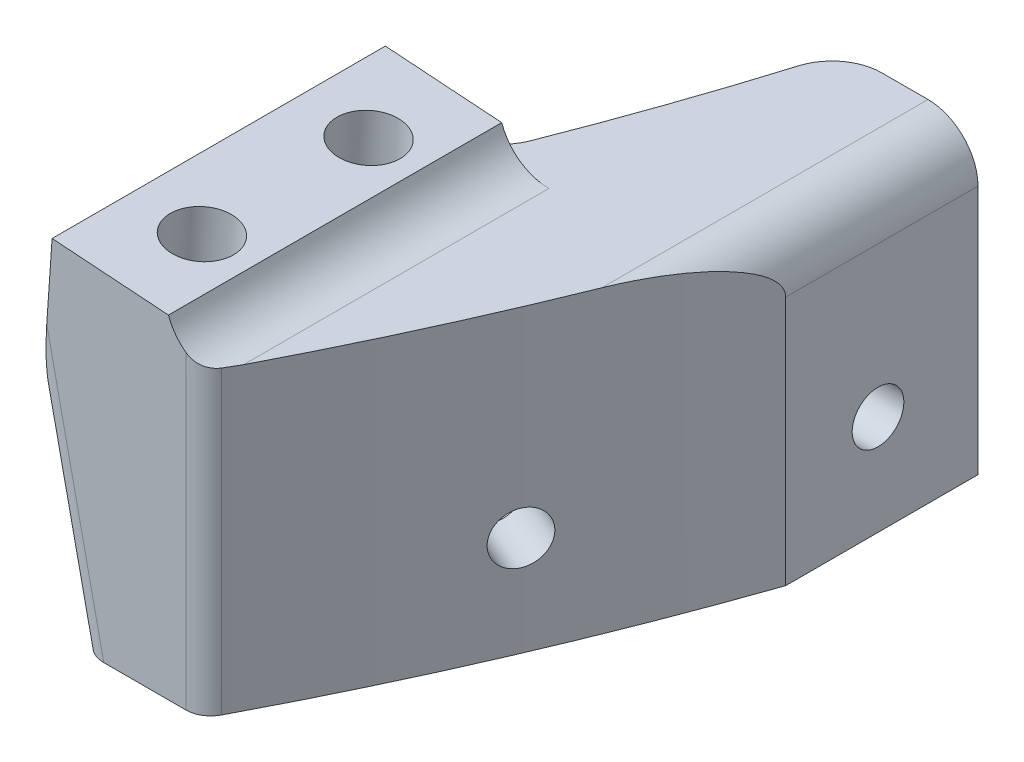
from build123d import *

# Parameters (mm, degrees)
BOSS_EXTRU_1_DEPTH      = 12
BOSS_EXTRU_1_DEPTH_BACK = 6
ENL_V_MAT_EXTRU_1_DEPTH = 168.845911478
BOSS_EXTRU_2_DEPTH      = 20
ENL_V_MAT_EXTRU_2_DEPTH = 169.042623851
ESQUISSE5_R             = 1.9
ENL_V_MAT_EXTRU_3_DEPTH = 10
CONG_1_R                = 3
CONG_2_R                = 1.5


with BuildPart() as part:
    # Esquisse1 → Boss.-Extru.1 (new, two sides: drawn at the far end of the back side and taken through both)
    with BuildSketch(Plane(origin=(0, 0, 0), x_dir=(1, 0, 0), z_dir=(0, 1, 0)).offset(-BOSS_EXTRU_1_DEPTH_BACK)):
        with BuildLine():
            Line((142.5, -81), (152.865954352, -81))
            ThreePointArc((152.865954352, -81), (158.655064541, -68.975144042), (163.5, -56.539808984))
            Line((163.5, -56.539808984), (163.5, -45))
            Line((163.5, -45), (155.5, -45))
            ThreePointArc((155.5, -45), (152.933130519, -53.072663298), (149.947490809, -61))
            Line((149.947490809, -61), (142.5, -61))
            Line((142.5, -61), (142.5, -81))
        make_face()
    extrude(amount=BOSS_EXTRU_1_DEPTH + BOSS_EXTRU_1_DEPTH_BACK)

    # Esquisse2 → Enlèv. mat.-Extru.1 (cut, through all)
    with BuildSketch(Plane.XY.offset(81)):
        Polygon((142.5, -6), (142.5, 12), (143.758682615, 12), align=None)
    extrude(amount=-ENL_V_MAT_EXTRU_1_DEPTH, mode=Mode.SUBTRACT)

    # Esquisse3 → Boss.-Extru.2 (add)
    with BuildSketch(Plane.XY.offset(81)):
        Polygon((143.758682615, 12), (143.933073799, 14.493910126), (150.916022151, 14.005614809), (150.916022151, 12), align=None)
    extrude(amount=-BOSS_EXTRU_2_DEPTH)

    # Esquisse4 → Enlèv. mat.-Extru.2 (cut, through all)
    with BuildSketch(Plane.XY.offset(81)):
        Polygon((142.5, -6), (143.235509062, 4.518269623), (145.5, -6), align=None)
    extrude(amount=-ENL_V_MAT_EXTRU_2_DEPTH, mode=Mode.SUBTRACT)

    # Esquisse5 → Enlèv. mat.-Extru.3 (cut)
    with BuildSketch(Plane(origin=(1.708954599, 24.439189363, 0), x_dir=(0.9975640502598248, -0.06975647374411768, 0), z_dir=(0.06975647374411768, 0.9975640502598248, 0))):
        with Locations(Location((146.571416004, -66, 0), (0, 0, 180))):
            Circle(ESQUISSE5_R)
        with Locations((146.571416004, -76)):
            Circle(ESQUISSE5_R)
    extrude(amount=-ENL_V_MAT_EXTRU_3_DEPTH, mode=Mode.SUBTRACT)

    # Esquisse7 → Enlèvement de matière-Révolution1 (revolve, cut)
    with BuildSketch(Plane(origin=(0, 0, 0), x_dir=(1, 0, 0), z_dir=(0, 1, 0)), mode=Mode.PRIVATE) as enl_vement_de_mati_re_r_volution1_sk:
        Polygon((156.5, -52.9), (160, -52.9), (160, -52.55), (163.5, -52.55), (163.5, -51), (150.916022151, -51), (150.916022151, -53.884605954), align=None)
    revolve(enl_vement_de_mati_re_r_volution1_sk.sketch.rotate(Axis((150.916022151, 0, 51), (-1, 0, 0)), 180), axis=Axis((150.916022151, 0, 51), (-1, 0, 0)), mode=Mode.SUBTRACT)

    # Congé1
    # the kernel refuses this fillet: 3 mm, written as the material it adds along each edge
    with BuildSketch(Plane(origin=(150.916022151, 12, 81), x_dir=(0, 1, 0), z_dir=(0, 0, -1))) as cong_1_piece_1_section:
        with BuildLine():
            CenterArc((3, 2.830405994), CONG_1_R, 180, 70.642479406)
            Line((0, 2.830405994), (0, 0))
            Line((0, 0), (2.005614809, 0))
        make_face()
    cong_1_piece_1 = extrude(amount=20, mode=Mode.PRIVATE)
    cong_1_piece_1 = cong_1_piece_1 & Plane(origin=(0, 12, 0), x_dir=(0.8836182332495415, 0, 0.46820809248555173), z_dir=(0, -1, 0)) * Cylinder(173, 52, mode=Mode.PRIVATE)
    add(cong_1_piece_1)
    with BuildSketch(Plane(origin=(149.947490809, 12, 61), x_dir=(-1, 0, 0), z_dir=(0, -1, 0))) as cong_1_piece_2:
        with BuildLine():
            CenterArc((2.032083033, 3), CONG_1_R, 201.410940908, 68.589059092)
            ThreePointArc((-0.760875339, 1.904836298), (-0.383454711, 0.95121301), (0, 0))
            Line((0, 0), (2.032083033, 0))
        make_face()
    extrude(amount=18)
    # the kernel refuses this fillet: 3 mm, written as the material it takes off along each edge
    with BuildSketch(Plane(origin=(163.5, 12, 69.289808984), x_dir=(0, -1, 0), z_dir=(0, 0, -1))) as cong_1_2_piece_1:
        with BuildLine():
            CenterArc((CONG_1_R, CONG_1_R), CONG_1_R, 180, 90)
            Line((0, CONG_1_R), (0, 0))
            Line((0, 0), (CONG_1_R, 0))
        make_face()
    extrude(amount=31.789808984, mode=Mode.SUBTRACT)
    with BuildSketch(Plane(origin=(155.5, 17.5970247, 45), x_dir=(-0.2845583113069487, 0, 0.9586587335783978), z_dir=(0, -1, 0))) as cong_1_2_piece_2:
        with BuildLine():
            CenterArc((2.238904242, -2.999929578), CONG_1_R, 90.392583202, 73.074968252)
            Line((-0.637071959, -2.146254644), (0, 0))
            ThreePointArc((0, 0), (1.109174397, -0.003799974), (2.218348794, 0))
        make_face()
    extrude(amount=29.194049399, mode=Mode.SUBTRACT)

    # Esquisse8 → Enlèvement de matière-Révolution2 (revolve, cut)
    with BuildSketch(Plane(origin=(0, 0, 0), x_dir=(1, 0, 0), z_dir=(0, 1, 0)), mode=Mode.PRIVATE) as enl_vement_de_mati_re_r_volution2_sk:
        Polygon((143.15277955, -61.193532862), (159.075453795, -68), (159.68470235, -66.574757495), (156.466412822, -65.199034952), (156.603985076, -64.877205999), (153.385695549, -63.501483455), (144.614610154, -57.773806881), align=None)
    revolve(enl_vement_de_mati_re_r_volution2_sk.sketch.rotate(Axis((0, 0, 0), (0.9195112936111692, 0, 0.3930635838150288)), 180), axis=Axis((0, 0, 0), (0.9195112936111692, 0, 0.3930635838150288)), mode=Mode.SUBTRACT)

    # Congé2
    cong_2_edges = [part.edges().sort_by_distance(p)[0] for p in [
        (145.330393567, 4.371781028, 76),
        (149.121136958, 4.106706428, 66),
        (143.325850505, 4.098645221, 61),
        (144.367754531, -0.740865188, 81),
        (145.212814743, -4.66606136, 61),
        (152.865954352, 3, 81),
    ]]
    fillet(cong_2_edges, radius=CONG_2_R)


solid = part.part
